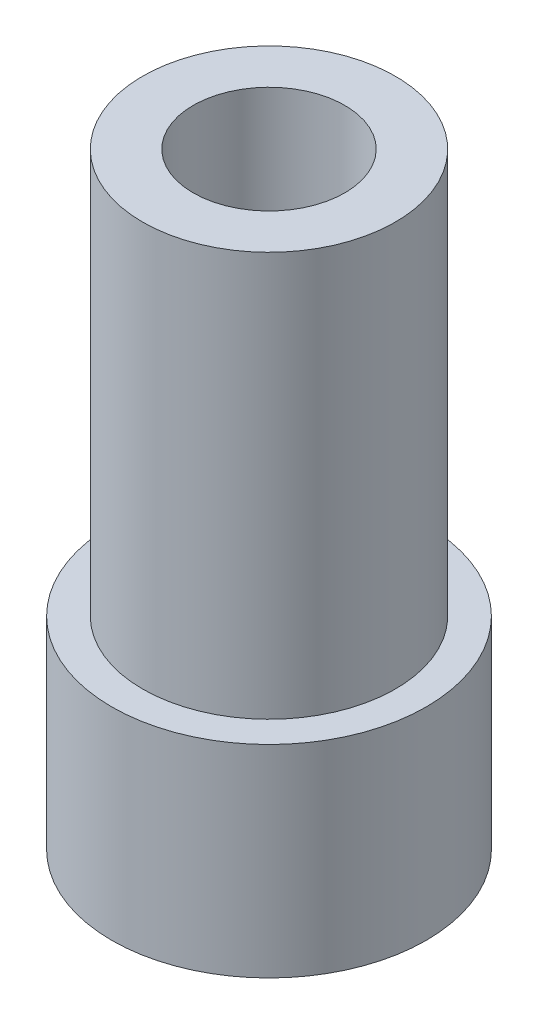
from build123d import *


with BuildPart() as part:
    # Esquisse1 → Révolution1 (revolve)
    with BuildSketch(Plane.XY):
        Polygon((1.5, 4), (1.5, -8), (3.111111111, -8), (3.111111111, -4), (2.5, -4), (2.5, 4), align=None)
    revolve(axis=Axis((0, 8.626576325, 0), (0, -1, 0)))


solid = part.part
